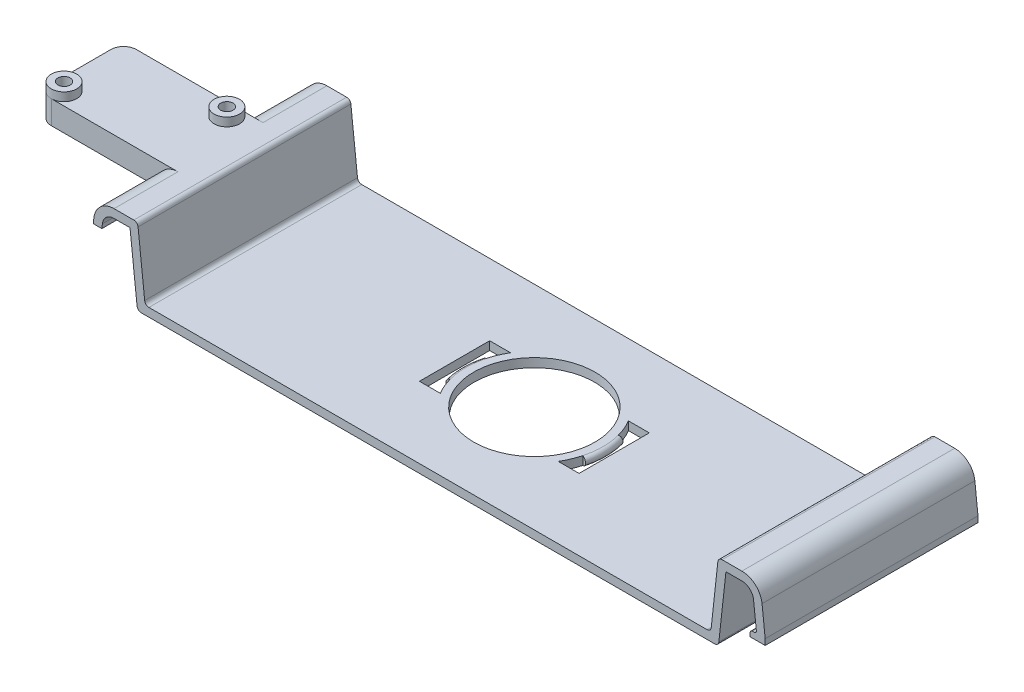
from build123d import *

# Parameters (mm, degrees)
BOSS_EXTRUDE1_DEPTH     = 25
SKETCH2_R               = 14.25
CUT_EXTRUDE1_DEPTH      = 50
CUT_EXTRUDE1_DRAFT      = -3
CUT_EXTRUDE2_DEPTH      = 85.581854283
REVOLVE1_ANGLE          = 30
FILLET1_R               = 0.2
FILLET4_R               = 1
BOSS_EXTRUDE2_START     = -25
BOSS_EXTRUDE2_DEPTH     = 50
FILLET5_R               = 0.5
BOSS_EXTRUDE3_DEPTH     = 10
SKETCH7_R               = 1.45
CUT_EXTRUDE3_DEPTH      = 111.865909999
BOSS_EXTRUDE5_START     = 2
SKETCH9_R               = 3
SKETCH9_R_2             = 1.45
BOSS_EXTRUDE5_DEPTH     = 2
FILLET6_R               = 3
CUT_EXTRUDE4_DEPTH      = 112.208138191
CUT_EXTRUDE4_DEPTH_BACK = 112.208138191
SKETCH10_W              = 29.886864559
SKETCH10_H              = 5.5


with BuildPart() as part:
    # Sketch1 → Boss-Extrude1 (new, symmetric)
    with BuildSketch(Plane.XY):
        with BuildLine():
            Line((0, 0), (-68.25, 0))
            Line((-68.25, 0), (-70, 16))
            Line((-70, 16), (-73.75, 16))
            ThreePointArc((-73.75, 16), (-75.596738759, 15.293339066), (-76.5, 13.534381178))
            Line((-76.5, 13.534381178), (-77.214697941, 7))
            Line((-77.214697941, 7), (-79.202841325, 7.217453183))
            Line((-79.202841325, 7.217453183), (-78.488143384, 13.75183436))
            ThreePointArc((-78.488143384, 13.75183436), (-76.931859285, 16.782450607), (-73.75, 18))
            Line((-73.75, 18), (-68.206822675, 18))
            Line((-68.206822675, 18), (-66.456822675, 2))
            Line((-66.456822675, 2), (0, 2))
            Line((0, 2), (0, 0))
        make_face()
    boss_extrude1 = extrude(amount=BOSS_EXTRUDE1_DEPTH, both=True)

    # Mirror1: Boss-Extrude1 across plane
    add(boss_extrude1.mirror(Plane(origin=(0, 0, 25), x_dir=(0, 0, 1), z_dir=(-1, 0, 0))))


with BuildPart() as cut_extrude1_tool:
    # Sketch2 → Cut-Extrude1 (with draft: the straight prism first)
    with BuildSketch(Plane(origin=(0, 2, 0), x_dir=(1, 0, 0), z_dir=(0, 1, 0))):
        Circle(SKETCH2_R)
    extrude(amount=-CUT_EXTRUDE1_DEPTH)
    # Cut-Extrude1: the draft: its side faces are tilted about the plane it starts from
    cut_extrude1_sides = [cut_extrude1_tool.faces().sort_by_distance(p)[0] for p in [
        (-14.25, -23, 0),
    ]]
    draft(cut_extrude1_sides, Plane(origin=(0, 2, 0), x_dir=(1, 0, 0), z_dir=(0, 1, 0)), CUT_EXTRUDE1_DRAFT)


with BuildPart() as part_1:
    add(part.part)

    # Cut-Extrude1: cut by cut_extrude1_tool
    add(cut_extrude1_tool.part, mode=Mode.SUBTRACT)

    # Sketch3 → Cut-Extrude2 (cut, through all)
    with BuildSketch(Plane(origin=(0, 2, 0), x_dir=(1, 0, 0), z_dir=(0, 1, 0))):
        with BuildLine():
            Line((-18.75, 8.25), (-18.75, -8.25))
            Line((-18.75, -8.25), (-13.854714901, -8.25))
            ThreePointArc((-13.854714901, -8.25), (-16.125, 0), (-13.854714901, 8.25))
            Line((-13.854714901, 8.25), (-18.75, 8.25))
        make_face()
        with BuildLine():
            Line((18.75, 8.25), (18.75, -8.25))
            Line((18.75, -8.25), (13.854714901, -8.25))
            ThreePointArc((13.854714901, -8.25), (16.125, 0), (13.854714901, 8.25))
            Line((13.854714901, 8.25), (18.75, 8.25))
        make_face()
    extrude(amount=-CUT_EXTRUDE2_DEPTH, mode=Mode.SUBTRACT)

    # Sketch4 → Revolve1 (revolve, symmetric)
    with BuildSketch(Plane.XY) as revolve1_sk:
        with BuildLine():
            Line((16.125, 0), (16.125, 2))
            ThreePointArc((16.125, 2), (17, 1), (16.125, 0))
        make_face()
    revolve1 = revolve(axis=Axis((0, 2, 0), (0, 1, 0)), revolution_arc=REVOLVE1_ANGLE / 2)
    revolve1 = revolve1 + revolve(revolve1_sk.sketch, axis=Axis((0, 2, 0), (0, -1, 0)), revolution_arc=REVOLVE1_ANGLE / 2)

    # Mirror2: Revolve1 across plane
    add(revolve1.mirror(Plane(origin=(0, 0, 0), x_dir=(0, 0, 1), z_dir=(1, 0, 0))))

    # Fillet1
    fillet1_edges = [part_1.edges().sort_by_distance(p)[0] for p in [
        (-70, 16, 0),
        (70, 16, 0),
    ]]
    fillet(fillet1_edges, radius=FILLET1_R)

    # Fillet4
    fillet4_edges = [part_1.edges().sort_by_distance(p)[0] for p in [
        (-68.25, 0, 0),
        (-68.206822675, 18, 0),
        (-66.456822675, 2, 0),
        (68.25, 0, 0),
        (68.206822675, 18, 0),
        (66.456822675, 2, 0),
    ]]
    fillet(fillet4_edges, radius=FILLET4_R)

    # Sketch6 → Boss-Extrude2 (add)
    with BuildSketch(Plane.XY.offset(BOSS_EXTRUDE2_START)):
        Polygon((79.226625267, 7), (79.226625267, 5.6), (75.714697941, 5.6), (75.714697941, 7), (77.214697941, 7), (79.202841325, 7.217453183), align=None)
    extrude(amount=BOSS_EXTRUDE2_DEPTH)

    # Fillet5
    fillet5_edges = [part_1.edges().sort_by_distance(p)[0] for p in [
        (75.714697941, 7, 0),
        (77.214697941, 7, 0),
    ]]
    fillet(fillet5_edges, radius=FILLET5_R)

    # Sketch5 → Boss-Extrude3 (add, symmetric)
    with BuildSketch(Plane.XY):
        with BuildLine():
            Line((-73.75, 18), (-106.5, 18))
            Line((-106.5, 18), (-106.5, 7))
            Line((-106.5, 7), (-77.214697941, 7))
            Line((-77.214697941, 7), (-76.5, 13.534381178))
            ThreePointArc((-76.5, 13.534381178), (-75.596738759, 15.293339066), (-73.75, 16))
            Line((-73.75, 16), (-73.75, 18))
        make_face()
    extrude(amount=BOSS_EXTRUDE3_DEPTH, both=True)

    # Sketch7 → Cut-Extrude3 (cut, through all)
    with BuildSketch(Plane(origin=(0, 18, 0), x_dir=(1, 0, 0), z_dir=(0, 1, 0))):
        with Locations(Location((-79.25, 7, 0), (0, 0, 270))):
            Circle(SKETCH7_R)
        with Locations(Location((-103.5, -7, 0), (0, 0, 270))):
            Circle(SKETCH7_R)
    extrude(amount=-CUT_EXTRUDE3_DEPTH, mode=Mode.SUBTRACT)

    # Sketch9 → Boss-Extrude5 (add)
    # profile 1 of 2: a face of its own
    with BuildSketch(Plane(origin=(0, 18, 0), x_dir=(1, 0, 0), z_dir=(0, 1, 0)).offset(BOSS_EXTRUDE5_START)):
        with Locations(Location((-79.25, 7, 0), (0, 0, 90))):
            Circle(SKETCH9_R)
        with Locations(Location((-79.25, 7, 0), (0, 0, 270))):
            Circle(SKETCH9_R_2, mode=Mode.SUBTRACT)
    # profile 2 of 2: a face of its own
    with BuildSketch(Plane(origin=(0, 18, 0), x_dir=(1, 0, 0), z_dir=(0, 1, 0)).offset(BOSS_EXTRUDE5_START)):
        with Locations(Location((-103.5, -7, 0), (0, 0, 270))):
            Circle(SKETCH9_R)
        with Locations(Location((-103.5, -7, 0), (0, 0, 270))):
            Circle(SKETCH9_R_2, mode=Mode.SUBTRACT)
    extrude(amount=-BOSS_EXTRUDE5_DEPTH)

    # Fillet6
    fillet6_edges = [part_1.edges().sort_by_distance(p)[0] for p in [
        (-106.5, 12.5, 10),
        (-106.5, 12.5, -10),
    ]]
    fillet(fillet6_edges, radius=FILLET6_R - 0.0001)  # a hair under: the kernel refuses the full size

    # Sketch10 → Cut-Extrude4 (cut, two sides: drawn at the far end of the back side and taken through both)
    with BuildSketch(Plane.XY.offset(-CUT_EXTRUDE4_DEPTH_BACK)):
        with Locations((-91.55656772, 9.75)):
            Rectangle(SKETCH10_W, SKETCH10_H)
    extrude(amount=CUT_EXTRUDE4_DEPTH + CUT_EXTRUDE4_DEPTH_BACK, mode=Mode.SUBTRACT)


solid = part_1.part
